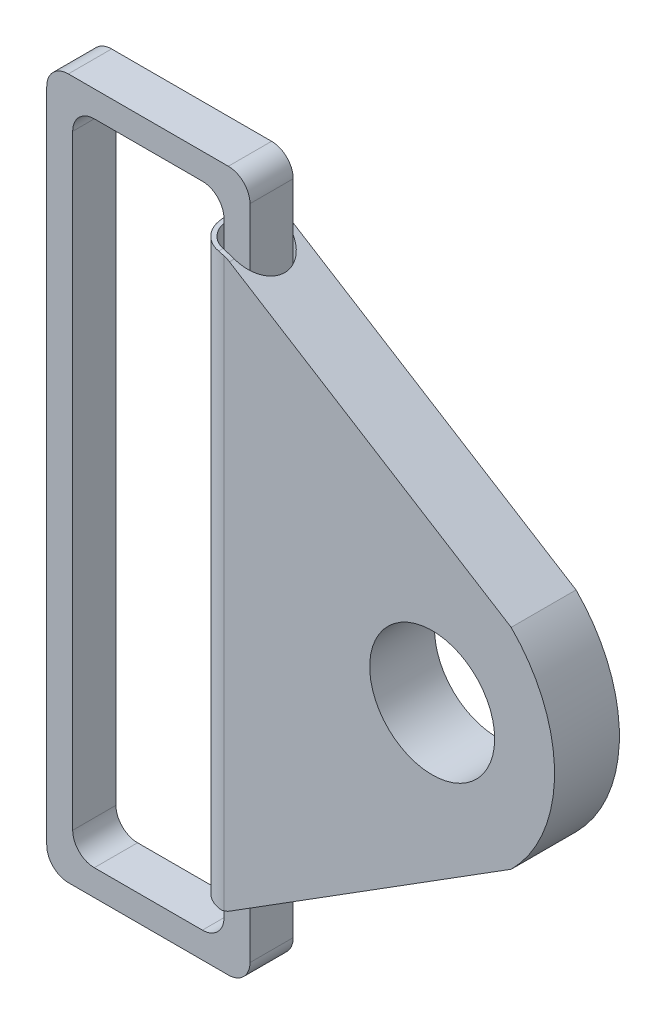
from build123d import *

# Parameters (mm, degrees)
SCHIZZO1_R                               = 2.88998006
ESTRUSIONE_ESTRUSIONE1_DEPTH             = 1.5
ESTRUSIONE_ESTRUSIONE3_REACH             = 22.293
SCHIZZO2_R                               = 1.5
ESTRUSIONE_ESTRUSIONE3_DIRECTION_2_REACH = 22.293
TAGLIO_ESTRUSIONE2_REACH                 = 22.922
SCHIZZO4_R                               = 1.297765186
TAGLIO_ESTRUSIONE2_DIRECTION_2_REACH     = 22.922
TAGLIO_ESTRUSIONE3_DEPTH                 = 21.921930902
TAGLIO_ESTRUSIONE3_DEPTH_BACK            = 21.921930902
RACCORDO3_R                              = 1
RACCORDO4_R                              = 1
SCHIZZO8_W                               = 9.4
SCHIZZO8_H                               = 32.4
SCHIZZO8_W_2                             = 7
SCHIZZO8_H_2                             = 30
ESTRUSIONE_SOTTILE1_DEPTH                = 1
RACCORDO9_R                              = 1
RACCORDO10_R                             = 1


with BuildPart() as part:
    # Schizzo1 → Estrusione-Estrusione1 (new, symmetric)
    with BuildSketch(Plane.XY):
        with BuildLine():
            Line((0, 13.049548457), (0, -13.268113525))
            Line((0, -13.268113525), (13.27389022, -4.921847321))
            ThreePointArc((13.27389022, -4.921847321), (15.281259891, -0.075628235), (13.27389022, 4.770590851))
            Line((13.27389022, 4.770590851), (0, 13.049548457))
        make_face()
        with Locations((9.620551337, -0.075628235)):
            Circle(SCHIZZO1_R, mode=Mode.SUBTRACT)
    extrude(amount=ESTRUSIONE_ESTRUSIONE1_DEPTH, both=True)

    # Estrusione-Estrusione3: up to this plane
    estrusione_estrusione3_end = Plane(origin=(0, -13.268113525, 1.5), z_dir=(-0.5322939659189773, 0.8465595867074254, 0))
    # Schizzo2 → Estrusione-Estrusione3 (add, up to the surface)
    with BuildSketch(Plane(origin=(0, 0, 0), x_dir=(1, 0, 0), z_dir=(0, 1, 0)), mode=Mode.PRIVATE) as estrusione_estrusione3_sk1:
        Circle(SCHIZZO2_R)
    estrusione_estrusione3_tool1 = split(extrude(estrusione_estrusione3_sk1.sketch, amount=-ESTRUSIONE_ESTRUSIONE3_REACH, mode=Mode.PRIVATE), bisect_by=estrusione_estrusione3_end, keep=Keep.BOTH, mode=Mode.PRIVATE)
    add(estrusione_estrusione3_tool1.solids().sort_by_distance((0, 0, 0))[0])

    # Estrusione-Estrusione3 direction 2: up to this plane
    estrusione_estrusione3_direction_2_end = Plane(origin=(0, 13.049548457, 1.5), z_dir=(-0.5292069948810272, -0.848492755755164, 0))
    # Schizzo2 → Estrusione-Estrusione3 direction 2 (add, up to the surface)
    with BuildSketch(Plane(origin=(0, 0, 0), x_dir=(1, 0, 0), z_dir=(0, 1, 0)), mode=Mode.PRIVATE) as estrusione_estrusione3_direction_2_sk1:
        Circle(SCHIZZO2_R)
    estrusione_estrusione3_direction_2_tool1 = split(extrude(estrusione_estrusione3_direction_2_sk1.sketch, amount=ESTRUSIONE_ESTRUSIONE3_DIRECTION_2_REACH, mode=Mode.PRIVATE), bisect_by=estrusione_estrusione3_direction_2_end, keep=Keep.BOTH, mode=Mode.PRIVATE)
    add(estrusione_estrusione3_direction_2_tool1.solids().sort_by_distance((0, 0, 0))[0])

    # Taglio-Estrusione2: up to this plane
    taglio_estrusione2_end = Plane(origin=(0, -13.268113525, 1.5), z_dir=(-0.5322939659189773, 0.8465595867074254, 0))
    # Schizzo4 → Taglio-Estrusione2 (cut, up to the surface)
    with BuildSketch(Plane(origin=(0, 0, 0), x_dir=(1, 0, 0), z_dir=(0, 1, 0)), mode=Mode.PRIVATE) as taglio_estrusione2_sk1:
        Circle(SCHIZZO4_R)
    taglio_estrusione2_tool1 = split(extrude(taglio_estrusione2_sk1.sketch, amount=-TAGLIO_ESTRUSIONE2_REACH, mode=Mode.PRIVATE), bisect_by=taglio_estrusione2_end, keep=Keep.BOTH, mode=Mode.PRIVATE)
    add(taglio_estrusione2_tool1.solids().sort_by_distance((0, 0, 0))[0], mode=Mode.SUBTRACT)

    # Taglio-Estrusione2 direction 2: up to this plane
    taglio_estrusione2_direction_2_end = Plane(origin=(0, 13.049548457, 1.5), z_dir=(-0.5292069948810272, -0.848492755755164, 0))
    # Schizzo4 → Taglio-Estrusione2 direction 2 (cut, up to the surface)
    with BuildSketch(Plane(origin=(0, 0, 0), x_dir=(1, 0, 0), z_dir=(0, 1, 0)), mode=Mode.PRIVATE) as taglio_estrusione2_direction_2_sk1:
        Circle(SCHIZZO4_R)
    taglio_estrusione2_direction_2_tool1 = split(extrude(taglio_estrusione2_direction_2_sk1.sketch, amount=TAGLIO_ESTRUSIONE2_DIRECTION_2_REACH, mode=Mode.PRIVATE), bisect_by=taglio_estrusione2_direction_2_end, keep=Keep.BOTH, mode=Mode.PRIVATE)
    add(taglio_estrusione2_direction_2_tool1.solids().sort_by_distance((0, 0, 0))[0], mode=Mode.SUBTRACT)

    # Schizzo5 → Taglio-Estrusione3 (cut, two sides: drawn at the far end of the back side and taken through both)
    with BuildSketch(Plane.XY.offset(-TAGLIO_ESTRUSIONE3_DEPTH_BACK)):
        Polygon((0, 13.049548457), (-1.5, 13.049548457), (-1.5, 13.985102104), align=None)
        Polygon((0, -13.268113525), (-1.5, -13.268113525), (-1.5, -14.2112733), align=None)
    extrude(amount=TAGLIO_ESTRUSIONE3_DEPTH + TAGLIO_ESTRUSIONE3_DEPTH_BACK, mode=Mode.SUBTRACT)

    # Raccordo3
    raccordo3_edges = [part.edges().sort_by_distance(p)[0] for p in [
        (0, 13.049548457, -1.398882593),
        (0, 13.049548457, 1.398882593),
    ]]
    fillet(raccordo3_edges, radius=RACCORDO3_R)

    # Raccordo4
    raccordo4_edges = [part.edges().sort_by_distance(p)[0] for p in [
        (0, -13.268113525, -1.398882593),
        (0, -13.268113525, 1.398882593),
    ]]
    fillet(raccordo4_edges, radius=RACCORDO4_R)


with BuildPart() as body_2:
    # Schizzo8 → Estrusione-Sottile1 (new, symmetric)
    with BuildSketch(Plane.XY):
        with Locations((-4.007903113, 0)):
            Rectangle(SCHIZZO8_W, SCHIZZO8_H)
        with Locations((-4.007903113, 0)):
            Rectangle(SCHIZZO8_W_2, SCHIZZO8_H_2, mode=Mode.SUBTRACT)
    extrude(amount=ESTRUSIONE_SOTTILE1_DEPTH, both=True)

    # Raccordo9
    raccordo9_edges = [body_2.edges().sort_by_distance(p)[0] for p in [
        (0.692096887, -16.2, 0),
        (-8.707903113, -16.2, 0),
        (0.692096887, 16.2, 0),
        (-8.707903113, 16.2, 0),
    ]]
    fillet(raccordo9_edges, radius=RACCORDO9_R)

    # Raccordo10
    raccordo10_edges = [body_2.edges().sort_by_distance(p)[0] for p in [
        (-0.507903113, -15, 0),
        (-7.507903113, -15, 0),
        (-0.507903113, 15, 0),
        (-7.507903113, 15, 0),
    ]]
    fillet(raccordo10_edges, radius=RACCORDO10_R)


solid = Compound([part.part, body_2.part])
